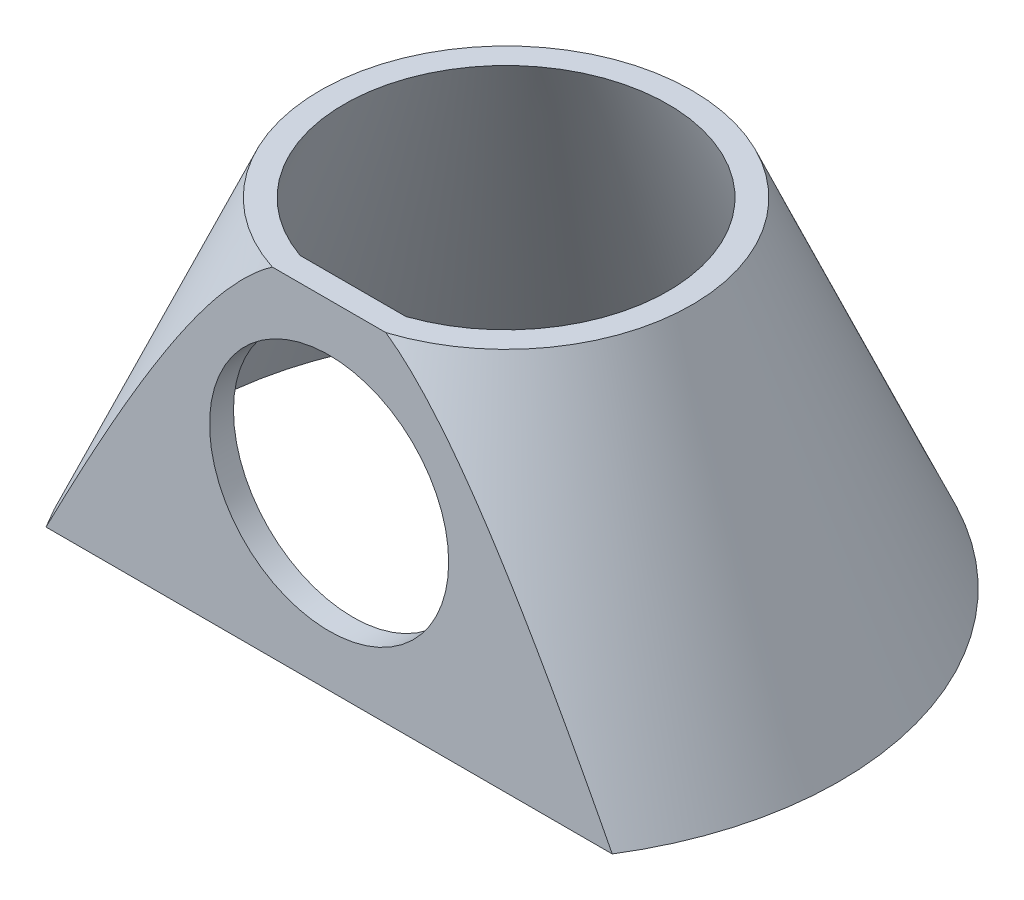
from build123d import *

# Parameters (mm, degrees)
CUT_EXTRUDE1_DEPTH      = 26.89826249
CUT_EXTRUDE1_DEPTH_BACK = 26.89826249
SKETCH4_W               = 44.770884432
SKETCH4_H               = 10.69042287
SKETCH6_W               = 24.706274506
SKETCH6_H               = 1
BOSS_EXTRUDE1_DEPTH     = 16
SKETCH8_W               = 44.013591964
SKETCH8_H               = 26.255140404
CUT_EXTRUDE2_DEPTH      = 0.85
SKETCH9_W               = 50.816359418
SKETCH9_H               = 30.548951937
CUT_EXTRUDE3_DEPTH      = 1
CUT_EXTRUDE4_REACH      = 30.403
SKETCH10_R              = 5


with BuildPart() as part:
    # Sketch3 → Revolve1 (revolve)
    with BuildSketch(Plane.XY):
        Polygon((-6.4, 13.316712654), (-7.4, 13.316712654), (-14.4, -2.683287346), (-13.4, -2.683287346), align=None)
    revolve(axis=Axis((0, 50, 0), (0, -1, 0)))

    # Sketch4 → Cut-Extrude1 (cut, two sides: drawn at the far end of the back side and taken through both)
    with BuildSketch(Plane(origin=(0, 13.316712654, 0), x_dir=(1, 0, 0), z_dir=(0, 1, 0)).offset(-CUT_EXTRUDE1_DEPTH_BACK)):
        with Locations((0.720276718, -12.745211435)):
            Rectangle(SKETCH4_W, SKETCH4_H)
    extrude(amount=CUT_EXTRUDE1_DEPTH + CUT_EXTRUDE1_DEPTH_BACK, mode=Mode.SUBTRACT)

    # Sketch6 → Boss-Extrude1 (add)
    with BuildSketch(Plane.XZ.offset(2.683287346)):
        with Locations((0, 6.9)):
            Rectangle(SKETCH6_W, SKETCH6_H)
    extrude(amount=-BOSS_EXTRUDE1_DEPTH)

    # Sketch7 → Cut-Revolve1 (revolve, cut)
    with BuildSketch(Plane(origin=(0, 0, 0), x_dir=(0, 0, -1), z_dir=(1, 0, 0))):
        Polygon((7.4, 13.316712654), (14.4, -2.683287346), (16.866286124, -2.683287346), (16.866286124, 13.316712654), align=None)
    revolve(axis=Axis((0, 14.930838331, 0), (0, -1, 0)), mode=Mode.SUBTRACT)

    # Sketch8 → Cut-Extrude2 (cut)
    with BuildSketch(Plane(origin=(0, 13.316712654, 0), x_dir=(1, 0, 0), z_dir=(0, 1, 0))):
        with Locations((-2.588663139, 4.329260992)):
            Rectangle(SKETCH8_W, SKETCH8_H)
    extrude(amount=-CUT_EXTRUDE2_DEPTH, mode=Mode.SUBTRACT)

    # Sketch9 → Cut-Extrude3 (cut)
    with BuildSketch(Plane.XZ.offset(2.683287346)):
        with Locations((0.819476292, -3.706436551)):
            Rectangle(SKETCH9_W, SKETCH9_H)
    extrude(amount=-CUT_EXTRUDE3_DEPTH, mode=Mode.SUBTRACT)

    # Sketch10 → Cut-Extrude4 (cut, up to next)
    with BuildSketch(Plane.XY.offset(7.4), mode=Mode.PRIVATE) as cut_extrude4_sk1:
        with Locations((0, 5.466712654)):
            Circle(SKETCH10_R)
    cut_extrude4_tool1 = extrude(cut_extrude4_sk1.sketch, amount=-CUT_EXTRUDE4_REACH, mode=Mode.PRIVATE) & part.part
    add(cut_extrude4_tool1.solids().sort_by_distance((0, 5.466713, 7.4))[0], mode=Mode.SUBTRACT)


solid = part.part
